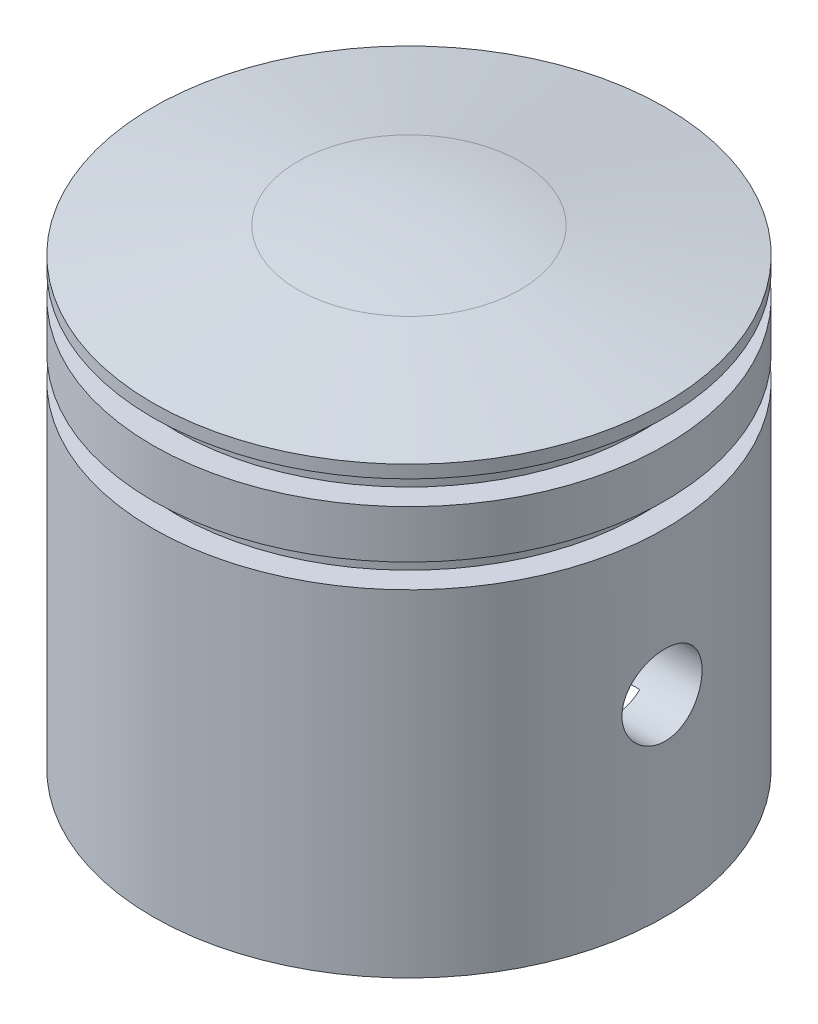
from build123d import *

# Parameters (mm, degrees)
SKETCH2_W               = 5.168520993
SKETCH2_H               = 1.5
SKETCH3_R               = 10
CUT_EXTRUDE1_DEPTH      = 24
SKETCH6_R               = 13
CUT_EXTRUDE2_DEPTH      = 10
CUT_EXTRUDE3_DEPTH      = 38.576588456
CUT_EXTRUDE3_DEPTH_BACK = 38.576588456
SKETCH7_R               = 2.5


with BuildPart() as part:
    # Sketch1 → Revolve2 (revolve)
    with BuildSketch(Plane.XY):
        with BuildLine():
            Line((0, 0), (16, 0))
            Line((16, 0), (16, 27.795832784))
            Line((16, 27.795832784), (6.945927107, 29.39231012))
            ThreePointArc((6.945927107, 29.39231012), (3.48622971, 29.847787924), (0, 30))
            Line((0, 30), (0, 0))
        make_face()
    revolve(axis=Axis((0, 30, 0), (0, -1, 0)))

    # Sketch2 → Cut-Revolve1 (revolve, cut)
    with BuildSketch(Plane(origin=(0, 0, 0), x_dir=(0, 0, -1), z_dir=(1, 0, 0))):
        with Locations((17.084260497, 26.25)):
            Rectangle(SKETCH2_W, SKETCH2_H)
        with Locations((17.084260497, 21.75)):
            Rectangle(SKETCH2_W, SKETCH2_H)
    revolve(axis=Axis((0, 0, 0), (0, 1, 0)), mode=Mode.SUBTRACT)

    # Sketch3 → Cut-Extrude1 (cut)
    with BuildSketch(Plane.XZ):
        Circle(SKETCH3_R)
    extrude(amount=-CUT_EXTRUDE1_DEPTH, mode=Mode.SUBTRACT)

    # Sketch6 → Cut-Extrude2 (cut)
    with BuildSketch(Plane.XZ):
        Circle(SKETCH6_R)
    extrude(amount=-CUT_EXTRUDE2_DEPTH, mode=Mode.SUBTRACT)

    # Sketch7 → Cut-Extrude3 (cut, two sides: drawn at the far end of the back side and taken through both)
    with BuildSketch(Plane(origin=(0, 0, 0), x_dir=(0, 0, -1), z_dir=(1, 0, 0)).offset(-CUT_EXTRUDE3_DEPTH_BACK)):
        with Locations((0, 12)):
            Circle(SKETCH7_R)
    extrude(amount=CUT_EXTRUDE3_DEPTH + CUT_EXTRUDE3_DEPTH_BACK, mode=Mode.SUBTRACT)


solid = part.part
